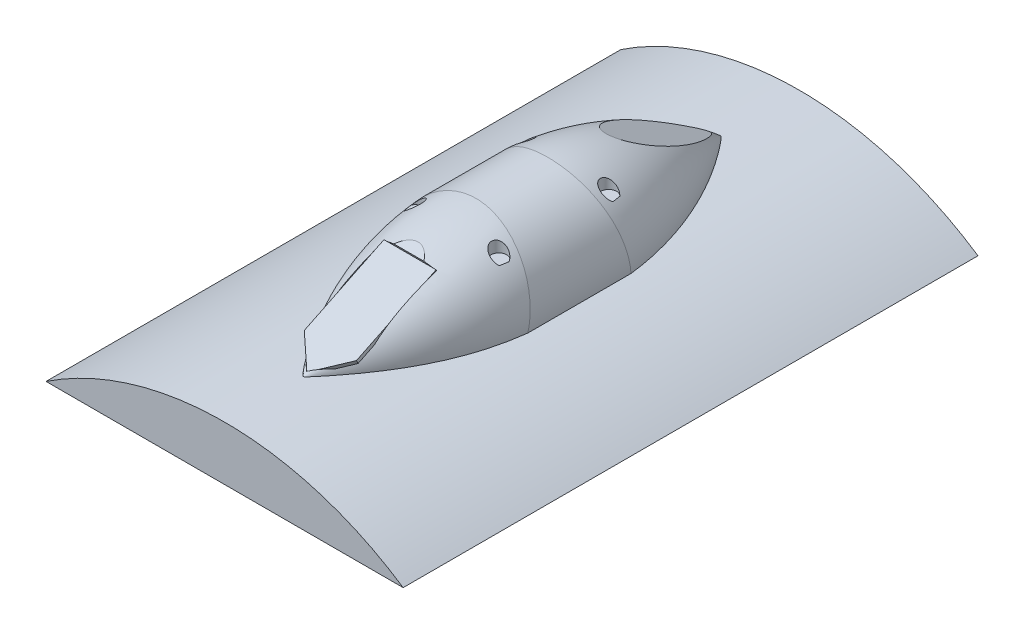
from build123d import *

# Parameters (mm, degrees)
SKETCH1_R                = 16.51
BOSS_EXTRUDE1_DEPTH      = 50.8
SKETCH2_R                = 78.359
CUT_EXTRUDE1_DEPTH       = 56.908856186
CUT_EXTRUDE9_DEPTH       = 56.908856339
CUT_EXTRUDE17_REACH      = 69.021
CUT_EXTRUDE17_START      = 11.1125
SKETCH21_R               = 1.905
CUT_EXTRUDE18_DEPTH      = 1.5875
BOSS_EXTRUDE4_REACH      = 73.976
BOSS_EXTRUDE5_REACH      = 73.976
SKETCH26_5_W             = 6.35
SKETCH26_5_H             = 0.9175
BOSS_EXTRUDE6_DEPTH      = 70
BOSS_EXTRUDE6_DEPTH_BACK = 70


with BuildPart() as part:
    # Sketch1 → Boss-Extrude1 (new body)
    with BuildSketch(Plane.XY):
        Circle(SKETCH1_R)
    boss_extrude1 = extrude(amount=BOSS_EXTRUDE1_DEPTH)

    # Sketch2 → Cut-Extrude1 (cut, through all)
    with BuildSketch(Plane(origin=(0, 0, 0), x_dir=(-1, 0, 0), z_dir=(0, 0, -1))):
        with Locations((0, -78.359)):
            Circle(SKETCH2_R)
    cut_extrude1 = extrude(amount=-CUT_EXTRUDE1_DEPTH, mode=Mode.SUBTRACT)

    # Sketch5 → Cut-Revolve2 (revolve, cut)
    with BuildSketch(Plane(origin=(0, 0, 0), x_dir=(0, 0, -1), z_dir=(1, 0, 0))):
        with BuildLine():
            Line((-2.54, 16.51), (-2.54, 26.67))
            Line((-2.54, 26.67), (-50.8, 26.67))
            Line((-50.8, 26.67), (-50.8, 0))
            ThreePointArc((-50.8, 0), (-28.230872285, 12.817549757), (-2.54, 16.51))
        make_face()
    cut_revolve2 = revolve(axis=Axis((0, -0.254, 0), (0, 0, 1)), mode=Mode.SUBTRACT)

    # Sketch13 → Cut-Extrude9 (cut, symmetric)
    with BuildSketch(Plane(origin=(0, 0, 0), x_dir=(0, 0, -1), z_dir=(1, 0, 0))):
        Polygon((-48.26, 2.053963368), (-22.86, 14.417354285), (-23.97164525, 16.701176704), (-49.37164525, 4.337785786), align=None)
    cut_extrude9 = extrude(amount=CUT_EXTRUDE9_DEPTH, both=True, mode=Mode.SUBTRACT)

    # Mirror1: Boss-Extrude1, Cut-Extrude1, Cut-Revolve2, Cut-Extrude9 across plane
    add(boss_extrude1.mirror(Plane.XY))
    add(cut_extrude1.mirror(Plane.XY), mode=Mode.SUBTRACT)
    add(cut_revolve2.mirror(Plane.XY), mode=Mode.SUBTRACT)
    add(cut_extrude9.mirror(Plane.XY), mode=Mode.SUBTRACT)

    # Sketch21 → Cut-Extrude17 (cut, up to next)
    with BuildSketch(Plane(origin=(0, 0, 0), x_dir=(1, 0, 0), z_dir=(0, 1, 0)).offset(CUT_EXTRUDE17_START), mode=Mode.PRIVATE) as cut_extrude17_sk1:
        with Locations((-10.17778, 13.3858)):
            Circle(SKETCH21_R)
    cut_extrude17_tool1 = extrude(cut_extrude17_sk1.sketch, amount=CUT_EXTRUDE17_REACH, mode=Mode.PRIVATE) & part.part
    # Sketch21 → Cut-Extrude17 (cut, up to next)
    with BuildSketch(Plane(origin=(0, 0, 0), x_dir=(1, 0, 0), z_dir=(0, 1, 0)).offset(CUT_EXTRUDE17_START), mode=Mode.PRIVATE) as cut_extrude17_sk2:
        with Locations((10.17778, 13.3858)):
            Circle(SKETCH21_R)
    cut_extrude17_tool2 = extrude(cut_extrude17_sk2.sketch, amount=CUT_EXTRUDE17_REACH, mode=Mode.PRIVATE) & part.part
    # Sketch21 → Cut-Extrude17 (cut, up to next)
    with BuildSketch(Plane(origin=(0, 0, 0), x_dir=(1, 0, 0), z_dir=(0, 1, 0)).offset(CUT_EXTRUDE17_START), mode=Mode.PRIVATE) as cut_extrude17_sk3:
        with Locations((10.17778, -13.3858)):
            Circle(SKETCH21_R)
    cut_extrude17_tool3 = extrude(cut_extrude17_sk3.sketch, amount=CUT_EXTRUDE17_REACH, mode=Mode.PRIVATE) & part.part
    # Sketch21 → Cut-Extrude17 (cut, up to next)
    with BuildSketch(Plane(origin=(0, 0, 0), x_dir=(1, 0, 0), z_dir=(0, 1, 0)).offset(CUT_EXTRUDE17_START), mode=Mode.PRIVATE) as cut_extrude17_sk4:
        with Locations((-10.17778, -13.3858)):
            Circle(SKETCH21_R)
    cut_extrude17_tool4 = extrude(cut_extrude17_sk4.sketch, amount=CUT_EXTRUDE17_REACH, mode=Mode.PRIVATE) & part.part
    add(cut_extrude17_tool1.solids().sort_by_distance((-10.17778, 11.1125, -13.3858))[0], mode=Mode.SUBTRACT)
    add(cut_extrude17_tool2.solids().sort_by_distance((10.17778, 11.1125, -13.3858))[0], mode=Mode.SUBTRACT)
    add(cut_extrude17_tool3.solids().sort_by_distance((10.17778, 11.1125, 13.3858))[0], mode=Mode.SUBTRACT)
    add(cut_extrude17_tool4.solids().sort_by_distance((-10.17778, 11.1125, 13.3858))[0], mode=Mode.SUBTRACT)

    # Sketch23 → Cut-Extrude18 (cut)
    with BuildSketch(Plane(origin=(0, 20.651568413, 10.052102888), x_dir=(1, 0, 0), z_dir=(0, 0.8991426843960562, 0.43765561015146875))):
        Polygon((-6.35, -16.764), (6.35, -16.764), (6.35, -38.354), (0, -44.704), (-6.35, -38.354), align=None)
    extrude(amount=-CUT_EXTRUDE18_DEPTH, mode=Mode.SUBTRACT)

    # Boss-Extrude4: up to this plane
    boss_extrude4_end = Plane(origin=(-22.352, -9.782478198, 20.097637282), z_dir=(0.7071067811865481, 0.30946924976243934, -0.6357898893907266))
    # Sketch26 → Boss-Extrude4 (add, up to the surface)
    with BuildSketch(Plane(origin=(0, -7.336858649, 15.073227961), x_dir=(1, 0, 0), z_dir=(0, -0.43765561015146887, 0.899142684396056)), mode=Mode.PRIVATE) as boss_extrude4_sk1:
        Polygon((-6.35, 22.298065882), (-6.35, 21.976268947), (-6.35, 21.380565882), (0, 21.380565882), (0, 22.298065882), align=None)
    boss_extrude4_tool1 = split(extrude(boss_extrude4_sk1.sketch, amount=BOSS_EXTRUDE4_REACH, mode=Mode.PRIVATE), bisect_by=boss_extrude4_end, keep=Keep.BOTH, mode=Mode.PRIVATE)
    add(boss_extrude4_tool1.solids().sort_by_distance((-3.175, 12.299802, 24.631327))[0])

    # Boss-Extrude5: up to this plane
    boss_extrude5_end = Plane(origin=(22.352, -9.782478198, 20.097637282), z_dir=(0.7071067811865481, -0.3094692497624392, 0.6357898893907264))
    # Sketch26<5> → Boss-Extrude5 (add, up to the surface)
    with BuildSketch(Plane(origin=(0, -7.336858649, 15.073227961), x_dir=(1, 0, 0), z_dir=(0, -0.43765561015146887, 0.899142684396056)), mode=Mode.PRIVATE) as boss_extrude5_sk1:
        with Locations((3.175, 21.839315882)):
            Rectangle(SKETCH26_5_W, SKETCH26_5_H)
    boss_extrude5_tool1 = split(extrude(boss_extrude5_sk1.sketch, amount=BOSS_EXTRUDE5_REACH, mode=Mode.PRIVATE), bisect_by=boss_extrude5_end, keep=Keep.BOTH, mode=Mode.PRIVATE)
    add(boss_extrude5_tool1.solids().sort_by_distance((3.175, 12.299802, 24.631327))[0])

    # Sketch27 → Boss-Extrude6 (add, two sides: drawn at the far end of the back side and taken through both)
    with BuildSketch(Plane.XY.offset(-BOSS_EXTRUDE6_DEPTH_BACK)):
        with BuildLine():
            ThreePointArc((-16.418127932, -1.739303079), (-30.49782972, -6.178564539), (-43.495005935, -13.179882641))
            Line((-43.495005935, -13.179882641), (43.495005935, -13.179882641))
            ThreePointArc((43.495005935, -13.179882641), (30.49782972, -6.178564539), (16.418127932, -1.739303079))
            ThreePointArc((16.418127932, -1.739303079), (0, 0), (-16.418127932, -1.739303079))
        make_face()
    extrude(amount=BOSS_EXTRUDE6_DEPTH + BOSS_EXTRUDE6_DEPTH_BACK)


solid = part.part
